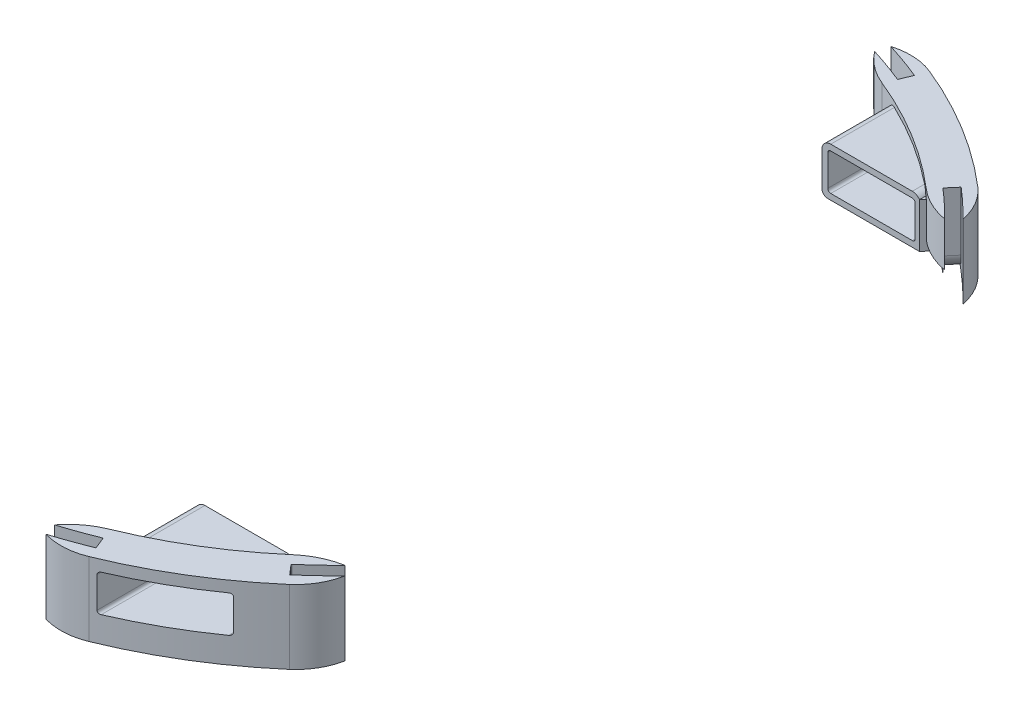
from build123d import *

# Parameters (mm, degrees)
EXTRUDE_1_DEPTH          = 25
EXTRUDE_2_DEPTH          = 25
EXTRUDE_START            = 10
EXTRUDE_3_DEPTH          = 15
CUT_EXTRUDE_1_DEPTH      = 182.665622814
CUT_EXTRUDE_1_DEPTH_BACK = 182.665622814
FILLET_1_R               = 5
EXTRUDE_START_2          = 3.25
EXTRUDE_4_DEPTH          = 3.25
CUT_EXTRUDE_2_DEPTH      = 182.665622814
CUT_EXTRUDE_2_DEPTH_BACK = 182.665622814
EXTRUDE_5_DEPTH          = 23
CUT_EXTRUDE_3_DEPTH      = 182.433075863
CUT_EXTRUDE_3_DEPTH_BACK = 182.433075863
CUT_EXTRUDE_4_DEPTH      = 181.561342805
CUT_EXTRUDE_4_DEPTH_BACK = 181.561342805
FILLET_2_R               = 2
EXTRUDE_6_DEPTH          = 11.990136
CUT_EXTRUDE_6_DEPTH      = 182.665622828
CUT_EXTRUDE_6_DEPTH_BACK = 182.665622828
SKETCH_6_W               = 139.474243904
SKETCH_6_H               = 184.495641706


# Read off the part's stored shape, not the designer's step: 보스-돌출2, 보스-돌출3
with BuildPart() as part:
    # 스케치1 → 보스-돌출1 (new body)
    with BuildSketch(Plane(origin=(0, 0, 0), x_dir=(1, 0, 0), z_dir=(0, 1, 0))):
        with BuildLine():
            Line((-97.902817909, -113.908200958), (-95.034825906, -110.571342874))
            ThreePointArc((-95.034825906, -110.571342874), (-76.04884266, -124.395391917), (-55.089620427, -134.991754271))
            Line((-55.089620427, -134.991754271), (-56.752132978, -139.065579503))
            ThreePointArc((-56.752132978, -139.065579503), (-78.343869462, -128.149436666), (-97.902817909, -113.908200958))
        make_face()
    extrude(amount=EXTRUDE_1_DEPTH)

    # 보스-돌출2 outline → 보스-돌출2 (add)
    with BuildSketch(Plane(origin=(0, 0, 0), x_dir=(1, 0, 0), z_dir=(0, 1, 0))):
        with BuildLine():
            ThreePointArc((-58.263507898, -142.769056678), (-51.401925813, -144.298824332), (-44.419555773, -143.481507746))
            ThreePointArc((-44.419555773, -143.481507746), (-50.634007907, -141.408052258), (-56.752132978, -139.065579503))
            ThreePointArc((-56.752132978, -139.065579503), (-78.343869462, -128.149436666), (-97.902817909, -113.908200958))
            ThreePointArc((-97.902817909, -113.908200958), (-102.778242062, -109.529324652), (-107.458021989, -104.941953051))
            ThreePointArc((-107.458021989, -104.941953051), (-105.001558912, -111.5309736), (-100.510083366, -116.941708307))
            ThreePointArc((-100.510083366, -116.941708307), (-80.430257464, -131.56220462), (-58.263507898, -142.769056678))
        make_face()
    extrude(amount=EXTRUDE_2_DEPTH)

    # 보스-돌출3 outline → 보스-돌출3 (add)
    with BuildSketch(Plane(origin=(0, 0, 0), x_dir=(1, 0, 0), z_dir=(0, 1, 0)).offset(EXTRUDE_START)):
        with BuildLine():
            ThreePointArc((-55.089620427, -134.991754271), (-49.15072139, -137.265605986), (-43.118317121, -139.278321101))
            ThreePointArc((-43.118317121, -139.278321101), (-47.816470696, -134.587095049), (-53.578245502, -131.288277085))
            ThreePointArc((-53.578245502, -131.288277085), (-73.962454658, -120.982623963), (-92.427560449, -107.537835525))
            ThreePointArc((-92.427560449, -107.537835525), (-97.99133688, -103.911679688), (-104.310117217, -101.867754693))
            ThreePointArc((-104.310117217, -101.867754693), (-99.767428046, -106.320742572), (-95.034825906, -110.571342874))
            ThreePointArc((-95.034825906, -110.571342874), (-76.04884266, -124.395391917), (-55.089620427, -134.991754271))
        make_face()
    extrude(amount=EXTRUDE_3_DEPTH)

    # 스케치3 → 컷-돌출1 (cut, two sides: drawn at the far end of the back side and taken through both)
    with BuildSketch(Plane(origin=(0, 25, 0), x_dir=(1, 0, 0), z_dir=(0, 1, 0)).offset(-CUT_EXTRUDE_1_DEPTH_BACK)):
        Polygon((-55.089620427, -134.991754271), (-55.274794301, -134.916185519), (-56.937306852, -138.990010751), (-56.752132978, -139.065579503), align=None)
        Polygon((-95.034825906, -110.571342874), (-94.883150539, -110.701706147), (-97.751142542, -114.038564231), (-97.902817909, -113.908200958), align=None)
    extrude(amount=CUT_EXTRUDE_1_DEPTH + CUT_EXTRUDE_1_DEPTH_BACK, mode=Mode.SUBTRACT)

    # 필렛1
    fillet_1_edges = [part.edges().sort_by_distance(p)[0] for p in [
        (-56.106050576, 0, 136.953098135),
        (-96.31714654, 0, 112.370135189),
    ]]
    fillet(fillet_1_edges, radius=FILLET_1_R)

    # 스케치5 → 보스-돌출4 (add)
    with BuildSketch(Plane.XZ.offset(-10).offset(EXTRUDE_START_2)):
        with BuildLine():
            Line((-53.578245381, 131.288276788), (-53.578245381, 106.288276788))
            Line((-53.578245381, 106.288276788), (-91.353578765, 106.288276788))
            Line((-91.353578765, 106.288276788), (-92.427560449, 107.537835525))
            Line((-92.427560449, 107.537835525), (-95.034825906, 110.571342874))
            ThreePointArc((-95.034825906, 110.571342874), (-76.134143992, 124.343202945), (-55.274742471, 134.916058513))
            Line((-55.274742471, 134.916058513), (-53.578245381, 131.288276788))
        make_face()
    extrude(amount=-EXTRUDE_4_DEPTH)

    # 스케치4 → 컷-돌출2 (cut, two sides: drawn at the far end of the back side and taken through both)
    with BuildSketch(Plane.XY.offset(-CUT_EXTRUDE_2_DEPTH_BACK)):
        with BuildLine():
            Line((-61.209825906, 8.75), (-88.909825906, 8.75))
            ThreePointArc((-88.909825906, 8.75), (-89.616932688, 9.042893219), (-89.909825906, 9.75))
            Line((-89.909825906, 9.75), (-89.909825906, 20.25))
            ThreePointArc((-89.909825906, 20.25), (-89.616932688, 20.957106781), (-88.909825906, 21.25))
            Line((-88.909825906, 21.25), (-61.209825906, 21.25))
            ThreePointArc((-61.209825906, 21.25), (-60.502719125, 20.957106781), (-60.209825906, 20.25))
            Line((-60.209825906, 20.25), (-60.209825906, 9.75))
            ThreePointArc((-60.209825906, 9.75), (-60.502719125, 9.042893219), (-61.209825906, 8.75))
        make_face()
    extrude(amount=CUT_EXTRUDE_2_DEPTH + CUT_EXTRUDE_2_DEPTH_BACK, mode=Mode.SUBTRACT)

    # 스케치7 → 보스-돌출5 (add)
    with BuildSketch(Plane(origin=(0, 0, 106.288276788), x_dir=(-1, 0, 0), z_dir=(0, 0, -1))):
        with BuildLine():
            Line((89.909825906, 10), (89.909825906, 20.25))
            ThreePointArc((89.909825906, 20.25), (89.616932688, 20.957106781), (88.909825906, 21.25))
            Line((88.909825906, 21.25), (61.209825906, 21.25))
            ThreePointArc((61.209825906, 21.25), (60.502719125, 20.957106781), (60.209825906, 20.25))
            Line((60.209825906, 20.25), (60.209825906, 10))
            Line((60.209825906, 10), (58.209825906, 10))
            Line((58.209825906, 10), (58.209825906, 20.25))
            ThreePointArc((58.209825906, 20.25), (59.088505563, 22.371320344), (61.209825906, 23.25))
            Line((61.209825906, 23.25), (88.909825906, 23.25))
            ThreePointArc((88.909825906, 23.25), (90.284524628, 22.91649647), (91.353578765, 21.990135617))
            Line((91.353578765, 21.990135617), (91.353578765, 20.25))
            Line((91.353578765, 20.25), (91.353578765, 10))
            Line((91.353578765, 10), (89.909825906, 10))
        make_face()
    extrude(amount=-EXTRUDE_5_DEPTH)

    # 스케치8 → 컷-돌출3 (cut, two sides: drawn at the far end of the back side and taken through both)
    with BuildSketch(Plane(origin=(0, 23.25, 0), x_dir=(1, 0, 0), z_dir=(0, 1, 0)).offset(-CUT_EXTRUDE_3_DEPTH_BACK)):
        with BuildLine():
            Line((-91.353578765, -124.226259892), (-91.353578765, -129.288276788))
            Line((-91.353578765, -129.288276788), (-88.909825906, -129.288276788))
            Line((-88.909825906, -129.288276788), (-84.0367865, -129.288276788))
            ThreePointArc((-84.0367865, -129.288276788), (-86.489060369, -127.660810105), (-88.909825906, -125.986836048))
            ThreePointArc((-88.909825906, -125.986836048), (-90.136000982, -125.11251467), (-91.353578765, -124.226259892))
        make_face()
    extrude(amount=CUT_EXTRUDE_3_DEPTH + CUT_EXTRUDE_3_DEPTH_BACK, mode=Mode.SUBTRACT)

    # 스케치9 → 컷-돌출4 (cut, two sides: drawn at the far end of the back side and taken through both)
    with BuildSketch(Plane(origin=(0, 10, 0), x_dir=(1, 0, 0), z_dir=(0, 1, 0)).offset(-CUT_EXTRUDE_4_DEPTH_BACK)):
        with BuildLine():
            Line((-53.578245381, -106.288276788), (-58.209825906, -106.288276788))
            Line((-58.209825906, -106.288276788), (-58.209825906, -129.288276788))
            Line((-58.209825906, -129.288276788), (-58.239003127, -129.288276788))
            ThreePointArc((-58.239003127, -129.288276788), (-55.917566703, -130.309116082), (-53.578245381, -131.288276788))
            Line((-53.578245381, -131.288276788), (-53.578245381, -106.288276788))
        make_face()
    extrude(amount=CUT_EXTRUDE_4_DEPTH + CUT_EXTRUDE_4_DEPTH_BACK, mode=Mode.SUBTRACT)

    # 필렛2
    # the kernel refuses this fillet: 2 mm, written as the material it takes off along each edge
    with BuildSketch(Plane(origin=(-58.209825906, 6.75, 134.288276788), x_dir=(0, 1, 0), z_dir=(0, 0, -1))) as fillet_2_piece_1_section:
        with BuildLine():
            CenterArc((FILLET_2_R, -FILLET_2_R), FILLET_2_R, 90, 90)
            Line((0, -FILLET_2_R), (0, 0))
            Line((0, 0), (FILLET_2_R, 0))
        make_face()
    fillet_2_piece_1 = extrude(amount=33, mode=Mode.PRIVATE)
    fillet_2_piece_1 = fillet_2_piece_1 & Plane(origin=(0, 7.198379441, 0), x_dir=(-0.4107122928578088, 0, 0.9117649985031678), z_dir=(0, -1, 0)) * Cylinder(141.8, 74, mode=Mode.PRIVATE)
    add(fillet_2_piece_1, mode=Mode.SUBTRACT)

    # 스케치10 → 보스-돌출6 (add)
    with BuildSketch(Plane(origin=(0, 10, 0), x_dir=(1, 0, 0), z_dir=(0, 1, 0))):
        with BuildLine():
            Line((-91.353578765, -108.451665025), (-91.353578765, -106.288276788))
            Line((-91.353578765, -106.288276788), (-92.427560449, -107.537835525))
            ThreePointArc((-92.427560449, -107.537835525), (-91.891705577, -107.996085328), (-91.353578765, -108.451665025))
        make_face()
    extrude(amount=EXTRUDE_6_DEPTH)


with BuildPart() as body_2:
    # 대칭 복사3: mirrored copy
    add(part.part.mirror(Plane(origin=(0, 0, 0), x_dir=(0, 0, 1), z_dir=(1, 0, 0))))


with BuildPart() as part_1:
    add(part.part)

    # 스케치6 → 컷-돌출6 (cut, two sides: drawn at the far end of the back side and taken through both)
    with BuildSketch(Plane(origin=(0, 0, 0), x_dir=(1, 0, 0), z_dir=(0, 1, 0)).offset(-CUT_EXTRUDE_6_DEPTH_BACK)):
        with Locations((-69.737121952, -92.247820853)):
            Rectangle(SKETCH_6_W, SKETCH_6_H)
    extrude(amount=CUT_EXTRUDE_6_DEPTH + CUT_EXTRUDE_6_DEPTH_BACK, mode=Mode.SUBTRACT)


with BuildPart() as body_2_2:
    # 대칭 복사5: mirrored copy
    add(body_2.part.mirror(Plane.XY))


solid = Compound([body_2.part, body_2_2.part])
